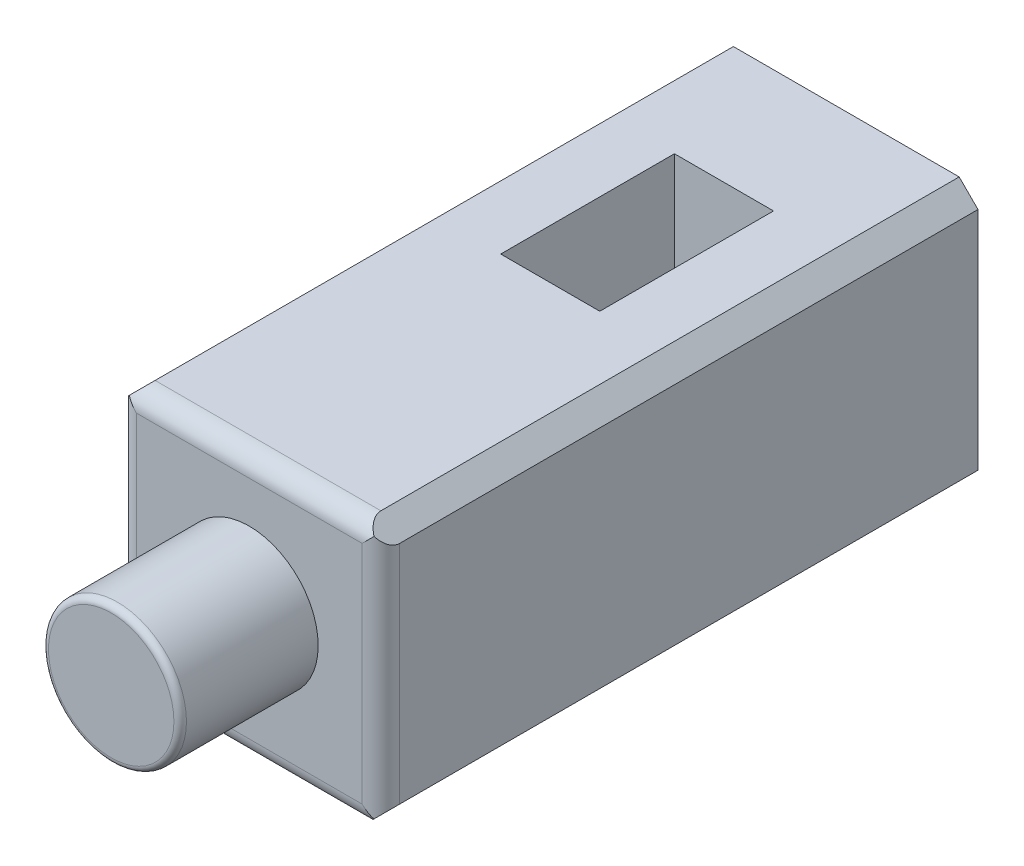
from build123d import *

# Parameters (mm, degrees)
SKETCH1_W           = 42
SKETCH1_H           = 42
BOSS_EXTRUDE1_DEPTH = 95.2
SKETCH2_R           = 11
BOSS_EXTRUDE2_DEPTH = 22
SKETCH3_W           = 15.8
SKETCH3_H           = 27.7
CUT_EXTRUDE1_DEPTH  = 21
SKETCH4_R           = 5
CUT_EXTRUDE2_DEPTH  = 10
CHAMFER1_SIZE       = 3
FILLET1_R           = 3
FILLET2_R           = 1


with BuildPart() as part:
    # Sketch1 → Boss-Extrude1 (new body)
    with BuildSketch(Plane.XY):
        Rectangle(SKETCH1_W, SKETCH1_H)
    extrude(amount=BOSS_EXTRUDE1_DEPTH)

    # Sketch2 → Boss-Extrude2 (add)
    with BuildSketch(Plane.XY.offset(95.2)):
        with Locations((0, 0.393132524)):
            Circle(SKETCH2_R)
    extrude(amount=BOSS_EXTRUDE2_DEPTH)

    # Sketch3 → Cut-Extrude1 (cut)
    with BuildSketch(Plane(origin=(0, 21, 0), x_dir=(1, 0, 0), z_dir=(0, 1, 0))):
        with Locations((0, -33.35)):
            Rectangle(SKETCH3_W, SKETCH3_H)
    extrude(amount=-CUT_EXTRUDE1_DEPTH, mode=Mode.SUBTRACT)

    # Sketch4 → Cut-Extrude2 (cut)
    with BuildSketch(Plane(origin=(0, 0, 0), x_dir=(-1, 0, 0), z_dir=(0, 0, -1))):
        Circle(SKETCH4_R)
    extrude(amount=-CUT_EXTRUDE2_DEPTH, mode=Mode.SUBTRACT)

    # Chamfer1
    chamfer1_edges = [part.edges().sort_by_distance(p)[0] for p in [
        (21, -21, 47.6),
        (-21, -21, 47.6),
        (-21, 21, 47.6),
        (21, 21, 47.6),
    ]]
    chamfer(chamfer1_edges, length=CHAMFER1_SIZE)

    # Fillet1
    # the kernel refuses this fillet: 3 mm, written as the material it takes off along each edge
    with BuildSketch(Plane(origin=(-21, 25.5, 95.2), x_dir=(1, 0, 0), z_dir=(0, -1, 0)), Plane(origin=(21, -25.5, 95.2), x_dir=(-1, 0, 0), z_dir=(0, 1, 0)), Plane(origin=(25.5, 21, 95.2), x_dir=(0, -1, 0), z_dir=(-1, 0, 0))) as fillet1_piece_1:
        with BuildLine():
            CenterArc((FILLET1_R, -FILLET1_R), FILLET1_R, 90, 90)
            Line((0, -FILLET1_R), (0, 0))
            Line((0, 0), (FILLET1_R, 0))
        make_face()
    extrude(amount=51, mode=Mode.SUBTRACT)
    with BuildSketch(Plane(origin=(-25.5, -21, 95.2), x_dir=(0, 0, -1), z_dir=(1, 0, 0))) as fillet1_piece_2:
        with BuildLine():
            CenterArc((FILLET1_R, FILLET1_R), FILLET1_R, 180, 90)
            Line((0, FILLET1_R), (0, 0))
            Line((0, 0), (FILLET1_R, 0))
        make_face()
    extrude(amount=51, mode=Mode.SUBTRACT)

    # Fillet2
    fillet2_edges = [part.edges().sort_by_distance(p)[0] for p in [
        (-11, 0.393132524, 117.2),
    ]]
    fillet(fillet2_edges, radius=FILLET2_R)


solid = part.part
